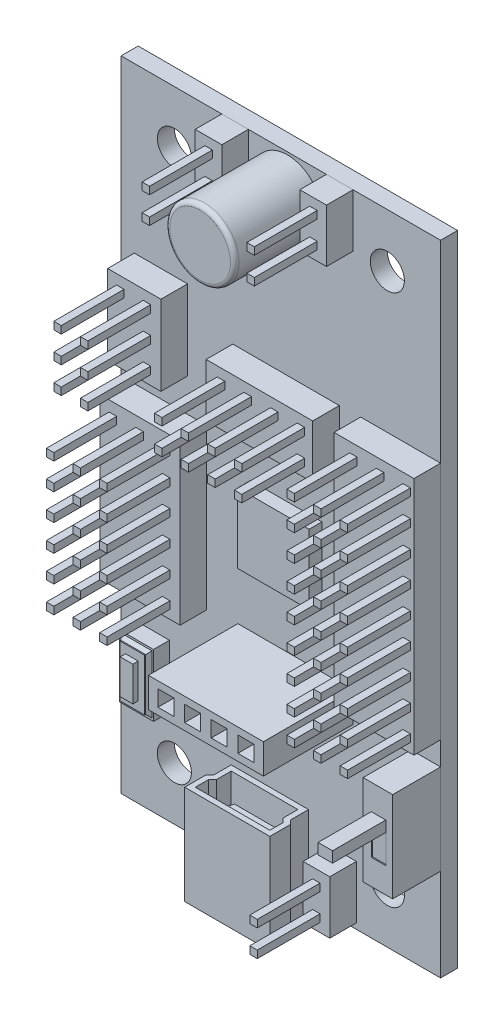
from build123d import *

# Parameters (mm, degrees)
ESQUISSE1_W             = 30
ESQUISSE1_H             = 60
BOSS_EXTRU_1_DEPTH      = 1.6
ESQUISSE2_R             = 1.6
ENL_V_MAT_EXTRU_1_DEPTH = 1.6
ESQUISSE3_W             = 0.7
ESQUISSE3_H             = 0.7
BOSS_EXTRU_2_DEPTH      = 8.4
ESQUISSE4_W             = 2.5
ESQUISSE4_H             = 5
BOSS_EXTRU_3_DEPTH      = 2.5
BOSS_EXTRU_3_2_DEPTH    = 2.5
ESQUISSE4_W_2           = 5
ESQUISSE4_H_2           = 7.5
BOSS_EXTRU_3_3_DEPTH    = 2.5
ESQUISSE4_W_3           = 10
BOSS_EXTRU_3_4_DEPTH    = 2.5
ESQUISSE4_W_4           = 7.5
ESQUISSE4_H_3           = 22.5
BOSS_EXTRU_3_5_DEPTH    = 2.5
ESQUISSE4_H_4           = 15
BOSS_EXTRU_3_6_DEPTH    = 2.5
BOSS_EXTRU_3_7_DEPTH    = 2.5
ESQUISSE5_W             = 10.8
ESQUISSE5_H             = 2.8
ESQUISSE5_W_2           = 1.5
ESQUISSE5_H_2           = 1.5
BOSS_EXTRU_4_DEPTH      = 8.4
ESQUISSE6_W             = 2.774040402
ESQUISSE6_H             = 8.483914792
BOSS_EXTRU_5_DEPTH      = 4.5
ESQUISSE7_W             = 1.356092784
ESQUISSE7_H             = 1.012294614
BOSS_EXTRU_6_DEPTH      = 5
EXTRU_MINCE1_DEPTH      = 1.8
EXTRU_MINCE1_DEPTH_BACK = 7.5
BOSS_EXTRU_7_DEPTH      = 1
BOSS_EXTRU_7_DEPTH_BACK = 5.5
ESQUISSE10_R            = 3.25
BOSS_EXTRU_8_DEPTH      = 8.2
CONG_1_R                = 0.4
ESQUISSE11_W            = 6.715385152
ESQUISSE11_H            = 6.549573172
BOSS_EXTRU_9_DEPTH      = 1.2
ESQUISSE12_W            = 3.167699546
ESQUISSE12_H            = 5.853357858
BOSS_EXTRU_10_DEPTH     = 1.5
ESQUISSE13_W            = 2.318388798
ESQUISSE13_H            = 4.866321042
BOSS_EXTRU_11_DEPTH     = 0.4
ESQUISSE14_W            = 1.193625916
ESQUISSE14_H            = 3.23656258
BOSS_EXTRU_12_DEPTH     = 0.5
CHANFREIN1_SIZE         = 0.3
ESQUISSE15_W            = 1.356092784
ESQUISSE15_H            = 2.695551592
ENL_V_MAT_EXTRU_3_DEPTH = 0.1


with BuildPart() as part:
    # Esquisse1 → Boss.-Extru.1 (new body)
    with BuildSketch(Plane.XY):
        with Locations((15, 30)):
            Rectangle(ESQUISSE1_W, ESQUISSE1_H)
    extrude(amount=BOSS_EXTRU_1_DEPTH)

    # Esquisse2 → Enlèv. mat.-Extru.1 (cut)
    with BuildSketch(Plane.XY.offset(1.6)):
        with Locations((5, 55)):
            Circle(ESQUISSE2_R)
        with Locations((25, 55)):
            Circle(ESQUISSE2_R)
        with Locations((25, 5)):
            Circle(ESQUISSE2_R)
        with Locations((5, 5)):
            Circle(ESQUISSE2_R)
    extrude(amount=-ENL_V_MAT_EXTRU_1_DEPTH, mode=Mode.SUBTRACT)

    # Esquisse3 → Boss.-Extru.2 (add)
    with BuildSketch(Plane.XY.offset(1.6)):
        with Locations((26.816713844, 40.590831868)):
            Rectangle(ESQUISSE3_W, ESQUISSE3_H)
        with Locations((24.316713844, 40.590831868)):
            Rectangle(ESQUISSE3_W, ESQUISSE3_H)
        with Locations((29.316713844, 40.590831868)):
            Rectangle(ESQUISSE3_W, ESQUISSE3_H)
        with Locations((24.316713844, 38.090831868)):
            Rectangle(ESQUISSE3_W, ESQUISSE3_H)
        with Locations((26.816713844, 38.090831868)):
            Rectangle(ESQUISSE3_W, ESQUISSE3_H)
        with Locations((29.316713844, 38.090831868)):
            Rectangle(ESQUISSE3_W, ESQUISSE3_H)
        with Locations((24.316713844, 35.590831868)):
            Rectangle(ESQUISSE3_W, ESQUISSE3_H)
        with Locations((26.816713844, 35.590831868)):
            Rectangle(ESQUISSE3_W, ESQUISSE3_H)
        with Locations((29.316713844, 35.590831868)):
            Rectangle(ESQUISSE3_W, ESQUISSE3_H)
        with Locations((24.316713844, 33.090831868)):
            Rectangle(ESQUISSE3_W, ESQUISSE3_H)
        with Locations((26.816713844, 33.090831868)):
            Rectangle(ESQUISSE3_W, ESQUISSE3_H)
        with Locations((29.316713844, 33.090831868)):
            Rectangle(ESQUISSE3_W, ESQUISSE3_H)
        with Locations((24.316713844, 30.590831868)):
            Rectangle(ESQUISSE3_W, ESQUISSE3_H)
        with Locations((26.816713844, 30.590831868)):
            Rectangle(ESQUISSE3_W, ESQUISSE3_H)
        with Locations((29.316713844, 30.590831868)):
            Rectangle(ESQUISSE3_W, ESQUISSE3_H)
        with Locations((24.316713844, 28.090831868)):
            Rectangle(ESQUISSE3_W, ESQUISSE3_H)
        with Locations((26.816713844, 28.090831868)):
            Rectangle(ESQUISSE3_W, ESQUISSE3_H)
        with Locations((29.316713844, 28.090831868)):
            Rectangle(ESQUISSE3_W, ESQUISSE3_H)
        with Locations((24.316713844, 25.590831868)):
            Rectangle(ESQUISSE3_W, ESQUISSE3_H)
        with Locations((26.816713844, 25.590831868)):
            Rectangle(ESQUISSE3_W, ESQUISSE3_H)
        with Locations((29.316713844, 25.590831868)):
            Rectangle(ESQUISSE3_W, ESQUISSE3_H)
        with Locations((24.316713844, 23.090831868)):
            Rectangle(ESQUISSE3_W, ESQUISSE3_H)
        with Locations((26.816713844, 23.090831868)):
            Rectangle(ESQUISSE3_W, ESQUISSE3_H)
        with Locations((29.316713844, 23.090831868)):
            Rectangle(ESQUISSE3_W, ESQUISSE3_H)
        with Locations((24.316713844, 20.590831868)):
            Rectangle(ESQUISSE3_W, ESQUISSE3_H)
        with Locations((26.816713844, 20.590831868)):
            Rectangle(ESQUISSE3_W, ESQUISSE3_H)
        with Locations((29.316713844, 20.590831868)):
            Rectangle(ESQUISSE3_W, ESQUISSE3_H)
        with Locations((4.229629407, 32.622560379)):
            Rectangle(ESQUISSE3_W, ESQUISSE3_H)
        with Locations((1.729629407, 32.622560379)):
            Rectangle(ESQUISSE3_W, ESQUISSE3_H)
        with Locations((6.729629407, 32.622560379)):
            Rectangle(ESQUISSE3_W, ESQUISSE3_H)
        with Locations((1.729629407, 30.122560379)):
            Rectangle(ESQUISSE3_W, ESQUISSE3_H)
        with Locations((4.229629407, 30.122560379)):
            Rectangle(ESQUISSE3_W, ESQUISSE3_H)
        with Locations((6.729629407, 30.122560379)):
            Rectangle(ESQUISSE3_W, ESQUISSE3_H)
        with Locations((1.729629407, 27.622560379)):
            Rectangle(ESQUISSE3_W, ESQUISSE3_H)
        with Locations((4.229629407, 27.622560379)):
            Rectangle(ESQUISSE3_W, ESQUISSE3_H)
        with Locations((6.729629407, 27.622560379)):
            Rectangle(ESQUISSE3_W, ESQUISSE3_H)
        with Locations((1.729629407, 25.122560379)):
            Rectangle(ESQUISSE3_W, ESQUISSE3_H)
        with Locations((4.229629407, 25.122560379)):
            Rectangle(ESQUISSE3_W, ESQUISSE3_H)
        with Locations((6.729629407, 25.122560379)):
            Rectangle(ESQUISSE3_W, ESQUISSE3_H)
        with Locations((1.729629407, 22.622560379)):
            Rectangle(ESQUISSE3_W, ESQUISSE3_H)
        with Locations((4.229629407, 22.622560379)):
            Rectangle(ESQUISSE3_W, ESQUISSE3_H)
        with Locations((6.729629407, 22.622560379)):
            Rectangle(ESQUISSE3_W, ESQUISSE3_H)
        with Locations((1.729629407, 20.122560379)):
            Rectangle(ESQUISSE3_W, ESQUISSE3_H)
        with Locations((4.229629407, 20.122560379)):
            Rectangle(ESQUISSE3_W, ESQUISSE3_H)
        with Locations((6.729629407, 20.122560379)):
            Rectangle(ESQUISSE3_W, ESQUISSE3_H)
        with Locations((10.716349761, 56.277207575)):
            Rectangle(ESQUISSE3_W, ESQUISSE3_H)
        with Locations((10.716349761, 58.777207575)):
            Rectangle(ESQUISSE3_W, ESQUISSE3_H)
        with Locations((20.559852029, 58.777207575)):
            Rectangle(ESQUISSE3_W, ESQUISSE3_H)
        with Locations((20.559852029, 56.277207575)):
            Rectangle(ESQUISSE3_W, ESQUISSE3_H)
        with Locations((20.834308546, 4.213106929)):
            Rectangle(ESQUISSE3_W, ESQUISSE3_H)
        with Locations((20.834308546, 1.713106929)):
            Rectangle(ESQUISSE3_W, ESQUISSE3_H)
        with Locations((4.92593128, 38.299792432)):
            Rectangle(ESQUISSE3_W, ESQUISSE3_H)
        with Locations((2.42593128, 38.299792432)):
            Rectangle(ESQUISSE3_W, ESQUISSE3_H)
        with Locations((2.42593128, 40.799792432)):
            Rectangle(ESQUISSE3_W, ESQUISSE3_H)
        with Locations((4.92593128, 40.799792432)):
            Rectangle(ESQUISSE3_W, ESQUISSE3_H)
        with Locations((2.42593128, 43.299792432)):
            Rectangle(ESQUISSE3_W, ESQUISSE3_H)
        with Locations((4.92593128, 43.299792432)):
            Rectangle(ESQUISSE3_W, ESQUISSE3_H)
        with Locations((14.38329979, 38.050914313)):
            Rectangle(ESQUISSE3_W, ESQUISSE3_H)
        with Locations((11.88329979, 38.050914313)):
            Rectangle(ESQUISSE3_W, ESQUISSE3_H)
        with Locations((16.88329979, 38.050914313)):
            Rectangle(ESQUISSE3_W, ESQUISSE3_H)
        with Locations((19.38329979, 38.050914313)):
            Rectangle(ESQUISSE3_W, ESQUISSE3_H)
        with Locations((11.88329979, 40.550914313)):
            Rectangle(ESQUISSE3_W, ESQUISSE3_H)
        with Locations((14.38329979, 40.550914313)):
            Rectangle(ESQUISSE3_W, ESQUISSE3_H)
        with Locations((16.88329979, 40.550914313)):
            Rectangle(ESQUISSE3_W, ESQUISSE3_H)
        with Locations((19.38329979, 40.550914313)):
            Rectangle(ESQUISSE3_W, ESQUISSE3_H)
    extrude(amount=BOSS_EXTRU_2_DEPTH)



with BuildPart() as body_2:
    # Esquisse4 → Boss.-Extru.3 (new body)
    with BuildSketch(Plane.XY.offset(1.6)):
        with Locations((10.705048747, 57.5)):
            Rectangle(ESQUISSE4_W, ESQUISSE4_H)
    extrude(amount=BOSS_EXTRU_3_DEPTH)


with BuildPart() as body_3:
    # Esquisse4 → Boss.-Extru.3 2 (new body)
    with BuildSketch(Plane.XY.offset(1.6)):
        with Locations((20.530718057, 57.5)):
            Rectangle(ESQUISSE4_W, ESQUISSE4_H)
    extrude(amount=BOSS_EXTRU_3_2_DEPTH)


with BuildPart() as body_4:
    # Esquisse4 → Boss.-Extru.3 3 (new body)
    with BuildSketch(Plane.XY.offset(1.6)):
        with Locations((3.735825927, 40.823804325)):
            Rectangle(ESQUISSE4_W_2, ESQUISSE4_H_2)
    extrude(amount=BOSS_EXTRU_3_3_DEPTH)


with BuildPart() as body_5:
    # Esquisse4 → Boss.-Extru.3 4 (new body)
    with BuildSketch(Plane.XY.offset(1.6)):
        with Locations((15.487864785, 39.30200926)):
            Rectangle(ESQUISSE4_W_3, ESQUISSE4_H)
    extrude(amount=BOSS_EXTRU_3_4_DEPTH)


with BuildPart() as body_6:
    # Esquisse4 → Boss.-Extru.3 5 (new body)
    with BuildSketch(Plane.XY.offset(1.6)):
        with Locations((26.25, 30.621613603)):
            Rectangle(ESQUISSE4_W_4, ESQUISSE4_H_3)
    extrude(amount=BOSS_EXTRU_3_5_DEPTH)


with BuildPart() as body_7:
    # Esquisse4 → Boss.-Extru.3 6 (new body)
    with BuildSketch(Plane.XY.offset(1.6)):
        with Locations((4.284968892, 26.458344109)):
            Rectangle(ESQUISSE4_W_4, ESQUISSE4_H_4)
    extrude(amount=BOSS_EXTRU_3_6_DEPTH)


with BuildPart() as body_8:
    # Esquisse4 → Boss.-Extru.3 7 (new body)
    with BuildSketch(Plane.XY.offset(1.6)):
        with Locations((20.842344213, 3.029993014)):
            Rectangle(ESQUISSE4_W, ESQUISSE4_H)
    extrude(amount=BOSS_EXTRU_3_7_DEPTH)


with BuildPart() as body_9:
    # Esquisse5 → Boss.-Extru.4 (new body)
    with BuildSketch(Plane.XY.offset(1.6)):
        with Locations((16.361003179, 17.900435021)):
            Rectangle(ESQUISSE5_W, ESQUISSE5_H)
        with Locations((12.611003179, 17.900435021)):
            Rectangle(ESQUISSE5_W_2, ESQUISSE5_H_2, mode=Mode.SUBTRACT)
        with Locations((15.111003179, 17.900435021)):
            Rectangle(ESQUISSE5_W_2, ESQUISSE5_H_2, mode=Mode.SUBTRACT)
        with Locations((17.611003179, 17.900435021)):
            Rectangle(ESQUISSE5_W_2, ESQUISSE5_H_2, mode=Mode.SUBTRACT)
        with Locations((20.111003179, 17.900435021)):
            Rectangle(ESQUISSE5_W_2, ESQUISSE5_H_2, mode=Mode.SUBTRACT)
    extrude(amount=BOSS_EXTRU_4_DEPTH)


with BuildPart() as body_10:
    # Esquisse6 → Boss.-Extru.5 (new body)
    with BuildSketch(Plane.XY.offset(1.6)):
        with Locations((28.612979799, 12.923069307)):
            Rectangle(ESQUISSE6_W, ESQUISSE6_H)
    extrude(amount=BOSS_EXTRU_5_DEPTH)

    # Esquisse15 → Enlèv. mat.-Extru.3 (cut)
    with BuildSketch(Plane.XY.offset(6.1)):
        with Locations((28.673061016, 12.414019404)):
            Rectangle(ESQUISSE15_W, ESQUISSE15_H)
    extrude(amount=-ENL_V_MAT_EXTRU_3_DEPTH, mode=Mode.SUBTRACT)


with BuildPart() as body_11:
    # Esquisse7 → Boss.-Extru.6 (new body)
    with BuildSketch(Plane.XY.offset(6.1)):
        with Locations((28.673061016, 14.267942507)):
            Rectangle(ESQUISSE7_W, ESQUISSE7_H)
    extrude(amount=BOSS_EXTRU_6_DEPTH)


with BuildPart() as body_12:
    # Esquisse8 → Extru.-Mince1 (new, two sides: drawn at the far end of the back side and taken through both)
    with BuildSketch(Plane.XZ.offset(-EXTRU_MINCE1_DEPTH_BACK)):
        Polygon((10.33733303, 1.6), (10.33733303, 3.278771779), (9.966881782, 3.649223026), (9.966881782, 5.6), (17.966881782, 5.6), (17.966881782, 3.649223026), (17.596430535, 3.278771779), (17.596430535, 1.6), align=None)
        Polygon((10.83733303, 2.1), (10.83733303, 3.48587856), (10.466881782, 3.856329807), (10.466881782, 5.1), (17.466881782, 5.1), (17.466881782, 3.856329807), (17.096430535, 3.48587856), (17.096430535, 2.1), align=None, mode=Mode.SUBTRACT)
    extrude(amount=EXTRU_MINCE1_DEPTH + EXTRU_MINCE1_DEPTH_BACK)


with BuildPart() as part_1:
    add(part.part)

    add(body_12.part)  # Boss.-Extru.7 merges body 12
    # Esquisse9 → Boss.-Extru.7 (add, two sides: drawn at the far end of the back side and taken through both)
    with BuildSketch(Plane.XZ.offset(-BOSS_EXTRU_7_DEPTH_BACK)):
        Polygon((11.687489321, 2.631407759), (11.258632474, 4.00826395), (16.744965921, 4.00826395), (16.112966357, 2.631407759), align=None)
    extrude(amount=BOSS_EXTRU_7_DEPTH + BOSS_EXTRU_7_DEPTH_BACK)

    # Esquisse10 → Boss.-Extru.8 (add)
    with BuildSketch(Plane.XY.offset(1.6)):
        with Locations((15.616552413, 56.507782768)):
            Circle(ESQUISSE10_R)
    extrude(amount=BOSS_EXTRU_8_DEPTH)

    # Congé1
    cong_1_edges = [part_1.edges().sort_by_distance(p)[0] for p in [
        (12.366552413, 56.507782768, 9.8),
    ]]
    fillet(cong_1_edges, radius=CONG_1_R)

    # Esquisse11 → Boss.-Extru.9 (add)
    with BuildSketch(Plane.XY.offset(1.6)):
        with Locations((15.501017575, 28.256623479)):
            Rectangle(ESQUISSE11_W, ESQUISSE11_H)
    extrude(amount=BOSS_EXTRU_9_DEPTH)

    # Esquisse12 → Boss.-Extru.10 (add)
    with BuildSketch(Plane.XY.offset(1.6)):
        with Locations((2.953076281, 11.811082892)):
            Rectangle(ESQUISSE12_W, ESQUISSE12_H)
    extrude(amount=BOSS_EXTRU_10_DEPTH)

    # Esquisse13 → Boss.-Extru.11 (add)
    with BuildSketch(Plane.XY.offset(3.1)):
        with Locations((2.941599109, 11.822560064)):
            Rectangle(ESQUISSE13_W, ESQUISSE13_H)
    extrude(amount=BOSS_EXTRU_11_DEPTH)

    # Esquisse14 → Boss.-Extru.12 (add)
    with BuildSketch(Plane.XY.offset(3.5)):
        with Locations((2.907167592, 11.856991581)):
            Rectangle(ESQUISSE14_W, ESQUISSE14_H)
    extrude(amount=BOSS_EXTRU_12_DEPTH)

    # Chanfrein1
    chanfrein1_edges = [part_1.edges().sort_by_distance(p)[0] for p in [
        (2.941599109, 14.255720585, 3.1),
        (4.100793508, 11.822560064, 3.1),
        (2.941599109, 9.389399543, 3.1),
        (1.78240471, 11.822560064, 3.1),
    ]]
    chamfer(chanfrein1_edges, length=CHANFREIN1_SIZE)


solid = Compound([body_2.part, body_3.part, body_4.part, body_5.part, body_6.part, body_7.part, body_8.part, body_9.part, body_10.part, body_11.part, part_1.part])
